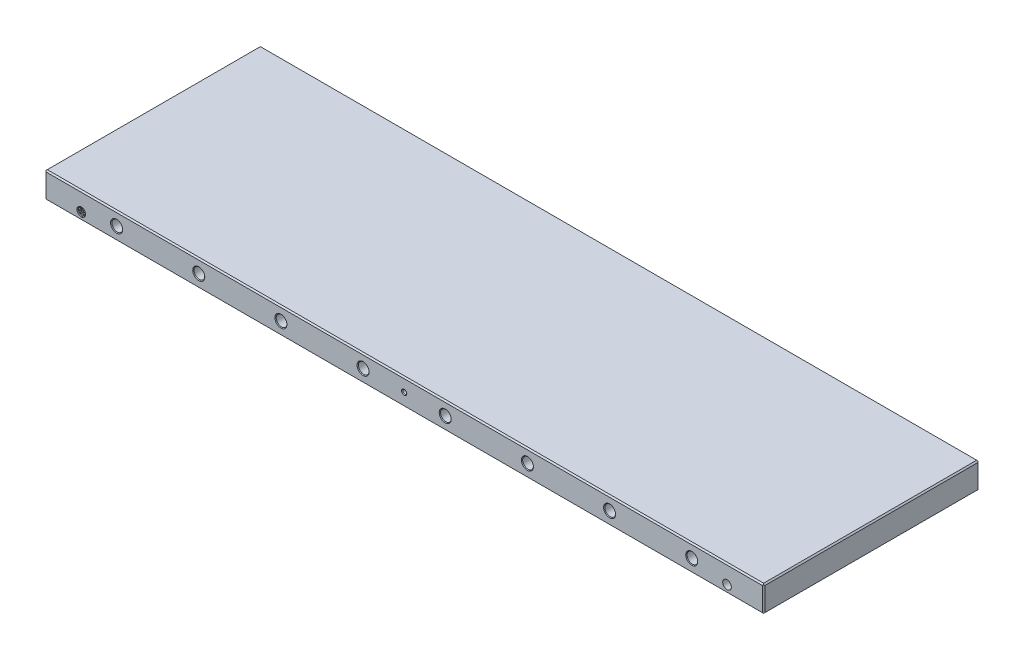
from build123d import *
from build123d.topology import SkipClean

# Parameters (mm, degrees)
SKETCH1_W           = 550
SKETCH1_H           = 165
BOSS_EXTRUDE1_DEPTH = 20
SKETCH2_R           = 4.1
CUT_EXTRUDE1_DEPTH  = 162
CHAMFER2_SIZE       = 0.5
CHAMFER3_SIZE       = 0.5
CHAMFER4_SIZE       = 1
CHAMFER5_SIZE       = 1
SKETCH3_R           = 1.5
CUT_EXTRUDE2_DEPTH  = 116
CHAMFER6_SIZE       = 0.5
SKETCH5_R           = 3.3
CUT_EXTRUDE3_DEPTH  = 10
SKETCH6_R           = 3.3
CUT_EXTRUDE4_DEPTH  = 10
THREAD1_PITCH       = 1
SKETCH10_R          = 3.3
CUT_EXTRUDE5_DEPTH  = 10
THREAD2_PITCH       = 1
THREAD3_PITCH       = 1


with BuildPart() as part:
    # Sketch1 → Boss-Extrude1 (new body)
    with BuildSketch(Plane(origin=(0, 0, 0), x_dir=(1, 0, 0), z_dir=(0, 1, 0))):
        Rectangle(SKETCH1_W, SKETCH1_H)
    extrude(amount=BOSS_EXTRUDE1_DEPTH)

    # Sketch2 → Cut-Extrude1 (cut)
    with BuildSketch(Plane.XY.offset(82.5)):
        with Locations((-220, 10)):
            Circle(SKETCH2_R)
        with Locations((-157.142857143, 10)):
            Circle(SKETCH2_R)
        with Locations((-94.285714286, 10)):
            Circle(SKETCH2_R)
        with Locations((-31.428571429, 10)):
            Circle(SKETCH2_R)
        with Locations((31.428571429, 10)):
            Circle(SKETCH2_R)
        with Locations((94.285714286, 10)):
            Circle(SKETCH2_R)
        with Locations((157.142857143, 10)):
            Circle(SKETCH2_R)
        with Locations((220, 10)):
            Circle(SKETCH2_R)
    extrude(amount=-CUT_EXTRUDE1_DEPTH, mode=Mode.SUBTRACT)

    # Chamfer2
    chamfer2_edges = [part.edges().sort_by_distance(p)[0] for p in [
        (215.9, 10, 82.5),
    ]]
    chamfer(chamfer2_edges, length=CHAMFER2_SIZE)

    # Chamfer3
    chamfer3_edges = [part.edges().sort_by_distance(p)[0] for p in [
        (-224.1, 10, 82.5),
        (-161.242857143, 10, 82.5),
        (-98.385714286, 10, 82.5),
        (-35.528571429, 10, 82.5),
        (27.328571429, 10, 82.5),
        (90.185714286, 10, 82.5),
        (153.042857143, 10, 82.5),
    ]]
    chamfer(chamfer3_edges, length=CHAMFER3_SIZE)

    # Chamfer4
    chamfer4_edges = [part.edges().sort_by_distance(p)[0] for p in [
        (275, 10, 82.5),
        (-275, 10, 82.5),
        (-275, 10, -82.5),
        (275, 10, -82.5),
    ]]
    chamfer(chamfer4_edges, length=CHAMFER4_SIZE)

    # Chamfer5
    # the kernel refuses this chamfer: 1 mm, written as the material it takes off along each edge
    with BuildSketch(Plane(origin=(276.571682988, 0, 82.5), x_dir=(0, 0.999621916911297, 0.02749587661058218), z_dir=(-1, 0, 0)), Plane(origin=(-276.571682988, 20, -82.5), x_dir=(0, 0.02749587661058574, 0.9996219169112968), z_dir=(1, 0, 0))) as chamfer5_piece_1:
        Polygon((CHAMFER5_SIZE * 0.999621916911, CHAMFER5_SIZE * 0.0274958766106), (-CHAMFER5_SIZE * 0.0274958766106, CHAMFER5_SIZE * 0.999621916911), (0, 0), align=None)
    extrude(amount=553.143365976, mode=Mode.SUBTRACT)
    with BuildSketch(Plane(origin=(-275, 0, 84.071682988), x_dir=(0.9996219169112968, -0.027495876610586483, 0), z_dir=(0, 0, -1)), Plane(origin=(275, 0, -84.071682988), x_dir=(-0.9996219169112968, -0.027495876610586483, 0), z_dir=(0, 0, 1))) as chamfer5_piece_2:
        Polygon((CHAMFER5_SIZE * 0.999621916911, -CHAMFER5_SIZE * 0.0274958766106), (-CHAMFER5_SIZE * 0.0274958766106, -CHAMFER5_SIZE * 0.999621916911), (0, 0), align=None)
    extrude(amount=168.143365976, mode=Mode.SUBTRACT)
    with BuildSketch(Plane(origin=(-276.571682988, 0, -82.5), x_dir=(0, -0.027495876610586483, 0.9996219169112968), z_dir=(1, 0, 0)), Plane(origin=(276.571682988, 20, 82.5), x_dir=(0, -0.999621916911297, 0.0274958766105822), z_dir=(-1, 0, 0))) as chamfer5_piece_3:
        Polygon((CHAMFER5_SIZE * 0.999621916911, -CHAMFER5_SIZE * 0.0274958766106), (-CHAMFER5_SIZE * 0.0274958766106, -CHAMFER5_SIZE * 0.999621916911), (0, 0), align=None)
    extrude(amount=553.143365976, mode=Mode.SUBTRACT)
    with BuildSketch(Plane(origin=(275, 20, -84.071682988), x_dir=(-0.9996219169112968, 0.02749587661058574, 0), z_dir=(0, 0, 1)), Plane(origin=(-275, 20, 84.071682988), x_dir=(0.9996219169112968, 0.02749587661058574, 0), z_dir=(0, 0, -1))) as chamfer5_piece_4:
        Polygon((CHAMFER5_SIZE * 0.999621916911, CHAMFER5_SIZE * 0.0274958766106), (-CHAMFER5_SIZE * 0.0274958766106, CHAMFER5_SIZE * 0.999621916911), (0, 0), align=None)
    extrude(amount=168.143365976, mode=Mode.SUBTRACT)

    # Sketch3 → Cut-Extrude2 (cut)
    with BuildSketch(Plane.XY.offset(82.5)):
        with Locations((0, 10)):
            Circle(SKETCH3_R)
    extrude(amount=-CUT_EXTRUDE2_DEPTH, mode=Mode.SUBTRACT)

    # Chamfer6
    chamfer6_edges = [part.edges().sort_by_distance(p)[0] for p in [
        (-1.5, 10, 82.5),
    ]]
    chamfer(chamfer6_edges, length=CHAMFER6_SIZE)

    # Sketch5 → Cut-Extrude3 (cut)
    with BuildSketch(Plane.XY.offset(82.5)):
        with Locations((-247.02, 6)):
            Circle(SKETCH5_R)
    extrude(amount=-CUT_EXTRUDE3_DEPTH, mode=Mode.SUBTRACT)

    # Sketch6 → Cut-Extrude4 (cut)
    with BuildSketch(Plane.XY.offset(82.5)):
        with Locations((246.98, 6)):
            Circle(SKETCH6_R)
    extrude(amount=-CUT_EXTRUDE4_DEPTH, mode=Mode.SUBTRACT)

    # Thread1: the profile of Thread Profile1 profile screwed along a right-hand helix of 10 turns, 8 arcs to a turn; built about Z, then put on its axis
    with SkipClean():  # the faces are left unmerged after this step: merging them gives an invalid solid
        thread1_z = Axis((0, 0, 0), (0, 0, 1))
        thread1_corners = [(3.3003, 0, -0.000173205), (3.3003, 0, 0.875173202), (2.758734125, 0, 0.562499999), (2.758734125, 0, 0.312499999)]
        with BuildLine(mode=Mode.PRIVATE) as thread1_profile:
            Line(thread1_corners[0], thread1_corners[1])
            Line(thread1_corners[1], thread1_corners[2])
            Line(thread1_corners[2], thread1_corners[3])
            Line(thread1_corners[3], thread1_corners[0])
        thread1_cap = Face(thread1_profile.wire())
        thread1_turn_angles = [0, 22.5, 45, 67.5, 90, 112.5, 135, 157.5, 180, 202.5, 225, 247.5, 270, 292.5, 315, 337.5, 360]
        thread1_turn_weights = [1, 0.9238795325112867, 1, 0.9238795325112867, 1, 0.9238795325112867, 1, 0.9238795325112867, 1, 0.9238795325112867, 1, 0.9238795325112867, 1, 0.9238795325112867, 1, 0.9238795325112867, 1]
        thread1_turn_rails = [Edge.make_bspline([Vector(p[0], p[1], 0).rotate(thread1_z, thread1_turn_angles[k]) / thread1_turn_weights[k] + Vector(0, 0, p[2] + THREAD1_PITCH * thread1_turn_angles[k] / 360) for k in range(17)], [0, 0, 0, 1, 1, 2, 2, 3, 3, 4, 4, 5, 5, 6, 6, 7, 7, 8, 8, 8], 2, thread1_turn_weights) for p in thread1_corners]
        thread1_turn_sides = [Face.make_surface_from_curves(thread1_turn_rails[p[0]], thread1_turn_rails[p[1]]) for p in [(0, 1), (1, 2), (2, 3), (3, 0)]]
        thread1 = Plane(origin=(-247.02, 6, 82.5), x_dir=(-1, 0, 0), z_dir=(0, 0, -1)) * Solid(Shell([*[p.moved(Location((0, 0, THREAD1_PITCH * i))) for i in range(10) for p in thread1_turn_sides], thread1_cap, thread1_cap.rotate(thread1_z, 3600).moved(Location((0, 0, THREAD1_PITCH * 3600 / 360)))]))
        add(thread1)

    # Sketch10 → Cut-Extrude5 (cut)
    with SkipClean():  # the faces are left unmerged after this step: merging them gives an invalid solid
        with BuildSketch(Plane(origin=(0, 0, -82.5), x_dir=(-1, 0, 0), z_dir=(0, 0, -1))):
            with Locations((247, 6)):
                Circle(SKETCH10_R)
            with Locations((-247, 6)):
                Circle(SKETCH10_R)
        extrude(amount=-CUT_EXTRUDE5_DEPTH, mode=Mode.SUBTRACT)

    # Thread2: the profile of Thread Profile2 profile screwed along a right-hand helix of 10 turns, 8 arcs to a turn; built about Z, then put on its axis
    with SkipClean():  # the faces are left unmerged after this step: merging them gives an invalid solid
        thread2_z = Axis((0, 0, 0), (0, 0, 1))
        thread2_corners = [(3.3003, 0, -0.000173205), (3.3003, 0, 0.875173202), (2.758734125, 0, 0.562499999), (2.758734125, 0, 0.312499999)]
        with BuildLine(mode=Mode.PRIVATE) as thread2_profile:
            Line(thread2_corners[0], thread2_corners[1])
            Line(thread2_corners[1], thread2_corners[2])
            Line(thread2_corners[2], thread2_corners[3])
            Line(thread2_corners[3], thread2_corners[0])
        thread2_cap = Face(thread2_profile.wire())
        thread2_turn_angles = [0, 22.5, 45, 67.5, 90, 112.5, 135, 157.5, 180, 202.5, 225, 247.5, 270, 292.5, 315, 337.5, 360]
        thread2_turn_weights = [1, 0.9238795325112867, 1, 0.9238795325112867, 1, 0.9238795325112867, 1, 0.9238795325112867, 1, 0.9238795325112867, 1, 0.9238795325112867, 1, 0.9238795325112867, 1, 0.9238795325112867, 1]
        thread2_turn_rails = [Edge.make_bspline([Vector(p[0], p[1], 0).rotate(thread2_z, thread2_turn_angles[k]) / thread2_turn_weights[k] + Vector(0, 0, p[2] + THREAD2_PITCH * thread2_turn_angles[k] / 360) for k in range(17)], [0, 0, 0, 1, 1, 2, 2, 3, 3, 4, 4, 5, 5, 6, 6, 7, 7, 8, 8, 8], 2, thread2_turn_weights) for p in thread2_corners]
        thread2_turn_sides = [Face.make_surface_from_curves(thread2_turn_rails[p[0]], thread2_turn_rails[p[1]]) for p in [(0, 1), (1, 2), (2, 3), (3, 0)]]
        thread2 = Plane(origin=(247, 6, -72.5), x_dir=(-1, 0, 0), z_dir=(0, 0, -1)) * Solid(Shell([*[p.moved(Location((0, 0, THREAD2_PITCH * i))) for i in range(10) for p in thread2_turn_sides], thread2_cap, thread2_cap.rotate(thread2_z, 3600).moved(Location((0, 0, THREAD2_PITCH * 3600 / 360)))]))
        add(thread2)

    # Thread3: the profile of Thread Profile3 profile screwed along a right-hand helix of 10 turns, 8 arcs to a turn; built about Z, then put on its axis
    with SkipClean():  # the faces are left unmerged after this step: merging them gives an invalid solid
        thread3_z = Axis((0, 0, 0), (0, 0, 1))
        thread3_corners = [(3.3003, 0, -0.000173205), (3.3003, 0, 0.875173202), (2.758734125, 0, 0.562499999), (2.758734125, 0, 0.312499999)]
        with BuildLine(mode=Mode.PRIVATE) as thread3_profile:
            Line(thread3_corners[0], thread3_corners[1])
            Line(thread3_corners[1], thread3_corners[2])
            Line(thread3_corners[2], thread3_corners[3])
            Line(thread3_corners[3], thread3_corners[0])
        thread3_cap = Face(thread3_profile.wire())
        thread3_turn_angles = [0, 22.5, 45, 67.5, 90, 112.5, 135, 157.5, 180, 202.5, 225, 247.5, 270, 292.5, 315, 337.5, 360]
        thread3_turn_weights = [1, 0.9238795325112867, 1, 0.9238795325112867, 1, 0.9238795325112867, 1, 0.9238795325112867, 1, 0.9238795325112867, 1, 0.9238795325112867, 1, 0.9238795325112867, 1, 0.9238795325112867, 1]
        thread3_turn_rails = [Edge.make_bspline([Vector(p[0], p[1], 0).rotate(thread3_z, thread3_turn_angles[k]) / thread3_turn_weights[k] + Vector(0, 0, p[2] + THREAD3_PITCH * thread3_turn_angles[k] / 360) for k in range(17)], [0, 0, 0, 1, 1, 2, 2, 3, 3, 4, 4, 5, 5, 6, 6, 7, 7, 8, 8, 8], 2, thread3_turn_weights) for p in thread3_corners]
        thread3_turn_sides = [Face.make_surface_from_curves(thread3_turn_rails[p[0]], thread3_turn_rails[p[1]]) for p in [(0, 1), (1, 2), (2, 3), (3, 0)]]
        thread3 = Plane(origin=(-247, 6, -72.5), x_dir=(-1, 0, 0), z_dir=(0, 0, -1)) * Solid(Shell([*[p.moved(Location((0, 0, THREAD3_PITCH * i))) for i in range(10) for p in thread3_turn_sides], thread3_cap, thread3_cap.rotate(thread3_z, 3600).moved(Location((0, 0, THREAD3_PITCH * 3600 / 360)))]))
        add(thread3)


solid = part.part
